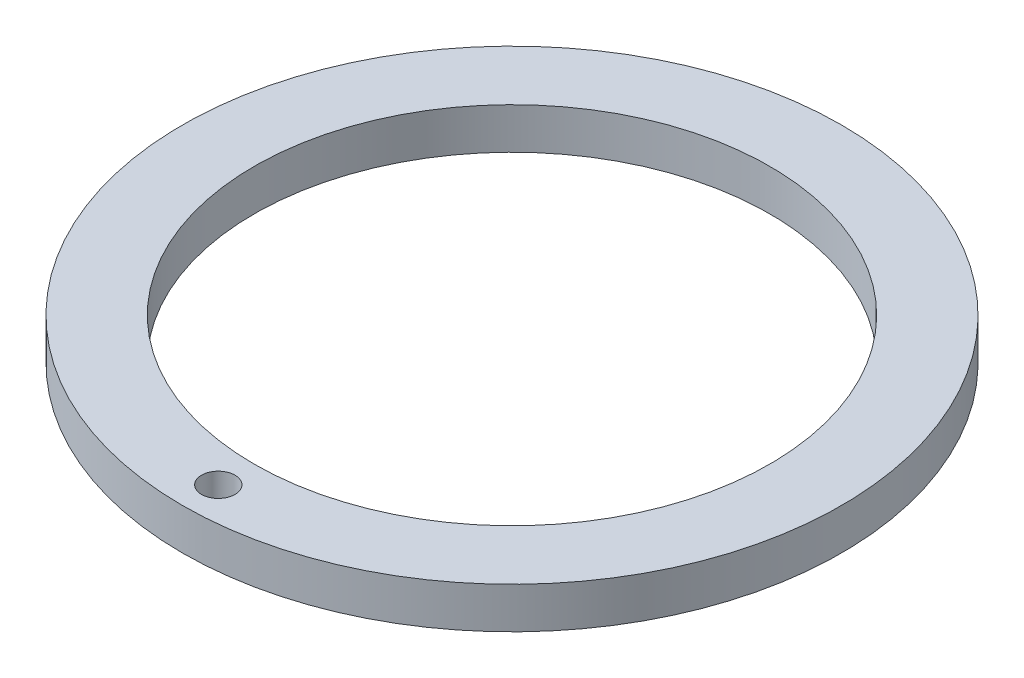
from build123d import *

# Parameters (mm, degrees)
SKETCH1_R            = 50.8
SKETCH1_R_2          = 39.751
RING_EXTRUSION_DEPTH = 6.35
SKETCH2_R            = 2.5796875
CONDUIT_HOLE_DEPTH   = 73.122135992


with BuildPart() as part:
    # Sketch1 → Ring Extrusion (new body)
    with BuildSketch(Plane(origin=(0, 0, 0), x_dir=(1, 0, 0), z_dir=(0, 1, 0))):
        Circle(SKETCH1_R)
        Circle(SKETCH1_R_2, mode=Mode.SUBTRACT)
    extrude(amount=RING_EXTRUSION_DEPTH)

    # Sketch2 → Conduit Hole (cut, through all)
    with BuildSketch(Plane(origin=(0, 0, 0), x_dir=(1, 0, 0), z_dir=(0, 1, 0))):
        with Locations((0, -45.2755)):
            Circle(SKETCH2_R)
    extrude(amount=CONDUIT_HOLE_DEPTH, mode=Mode.SUBTRACT)


solid = part.part
